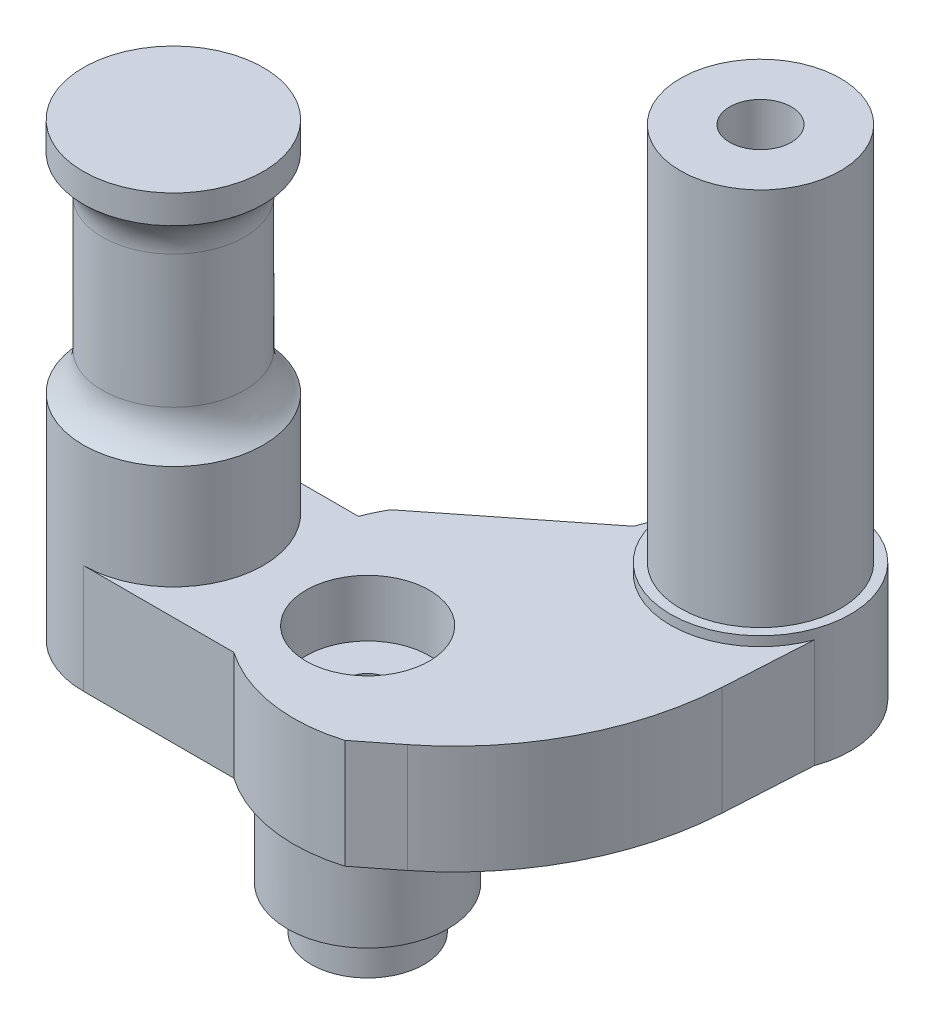
from build123d import *

# Parameters (mm, degrees)
SKETCH_1_R           = 5.95
EXTRUDE_1_DEPTH      = 4.5
SKETCH_4_R           = 8.45
EXTRUDE_4_DEPTH      = 17.75
EXTRUDE_6_DEPTH      = 5.75
EXTRUDE_6_DEPTH_BACK = 5.75
SKETCH_12_R          = 9.5
EXTRUDE_10_DEPTH     = 1
SKETCH_7_R           = 2.3
CUT_EXTRUDE_1_DEPTH  = 57.22806055
SKETCH_8_R           = 6.5
CUT_EXTRUDE_2_DEPTH  = 6
SKETCH_9_R           = 9.5
EXTRUDE_7_DEPTH      = 36
SKETCH_10_R          = 8.45
EXTRUDE_8_DEPTH      = 40
EXTRUDE_START        = 1
SKETCH_13_R          = 9.5
SKETCH_13_R_2        = 2.3
EXTRUDE_11_DEPTH     = 1
SKETCH_14_R          = 3.25
CUT_EXTRUDE_3_DEPTH  = 8
CUT_EXTRUDE_START    = -18
CUT_EXTRUDE_4_DEPTH  = 18
CUT_EXTRUDE_START_2  = 11
SKETCH_16_R          = 14.956390748
SKETCH_16_R_2        = 7.5
CUT_EXTRUDE_5_DEPTH  = 22
FILLET_2_R           = 5
SKETCH_18_R          = 7.5
EXTRUDE_12_DEPTH     = 11.5


with BuildPart() as part:
    # Эскиз1 → Бобышка-Вытянуть1 (new body)
    with BuildSketch(Plane(origin=(0, 0, 0), x_dir=(1, 0, 0), z_dir=(0, 1, 0))):
        with Locations(Location((0, 0, 0), (0, 0, 270))):
            Circle(SKETCH_1_R)
    extrude(amount=EXTRUDE_1_DEPTH)

    # Эскиз4 → Бобышка-Вытянуть4 (add)
    with BuildSketch(Plane(origin=(0, 4.5, 0), x_dir=(1, 0, 0), z_dir=(0, 1, 0))):
        with Locations(Location((0, 0, 0), (0, 0, 270))):
            Circle(SKETCH_4_R)
    extrude(amount=EXTRUDE_4_DEPTH)

    # Эскиз6 → Бобышка-Вытянуть6 (add, two sides: drawn at the far end of the back side and taken through both)
    with BuildSketch(Plane(origin=(0, 22.25, 0), x_dir=(1, 0, 0), z_dir=(0, 1, 0)).offset(-EXTRUDE_6_DEPTH_BACK)):
        with BuildLine():
            Line((-7.002075382, 9.5), (-30, 9.5))
            Line((-30, 9.5), (-30, -9.5))
            Line((-30, -9.5), (0, -9.5))
            Line((0, -9.5), (0.833655922, -9.5))
            ThreePointArc((0.833655922, -9.5), (3.331132848, -9.18310947), (5.670324417, -8.252521801))
            ThreePointArc((5.670324417, -8.252521801), (13.556905273, -2.05094269), (19.066851837, 6.333461279))
            Line((19.066851837, 6.333461279), (28.114764095, 31.1923959))
            Line((28.114764095, 31.1923959), (10.2606043, 37.690778624))
            Line((10.2606043, 37.690778624), (2.394850826, 16.079798567))
            ThreePointArc((2.394850826, 16.079798567), (-1.266311019, 11.308479557), (-7.002075382, 9.5))
        make_face()
    extrude(amount=EXTRUDE_6_DEPTH + EXTRUDE_6_DEPTH_BACK)

    # Эскиз12 → Бобышка-Вытянуть10 (add)
    with BuildSketch(Plane(origin=(0, 28, 0), x_dir=(1, 0, 0), z_dir=(0, 1, 0))):
        with Locations(Location((15.938492836, 25.514507365, 0), (0, 0, 70))):
            Circle(SKETCH_12_R)
    extrude(amount=EXTRUDE_10_DEPTH)

    # Эскиз7 → Вырез-Вытянуть1 (cut, through all)
    with BuildSketch(Plane.XZ):
        with Locations(Location((0, 0, 0), (0, 0, 270))):
            Circle(SKETCH_7_R)
    extrude(amount=-CUT_EXTRUDE_1_DEPTH, mode=Mode.SUBTRACT)

    # Эскиз8 → Вырез-Вытянуть2 (cut)
    with BuildSketch(Plane(origin=(0, 28, 0), x_dir=(1, 0, 0), z_dir=(0, 1, 0))):
        with Locations(Location((0, 0, 0), (0, 0, 270))):
            Circle(SKETCH_8_R)
    extrude(amount=-CUT_EXTRUDE_2_DEPTH, mode=Mode.SUBTRACT)

    # Эскиз9 → Бобышка-Вытянуть7 (add)
    with BuildSketch(Plane.XZ.offset(-28)):
        with Locations(Location((-20.5, 0, 0), (0, 0, 90))):
            Circle(SKETCH_9_R)
    extrude(amount=-EXTRUDE_7_DEPTH)

    # Эскиз10 → Бобышка-Вытянуть8 (add)
    with BuildSketch(Plane(origin=(0, 29, 0), x_dir=(1, 0, 0), z_dir=(0, 1, 0))):
        with Locations(Location((15.938492836, 25.514507365, 0), (0, 0, 270))):
            Circle(SKETCH_10_R)
    extrude(amount=EXTRUDE_8_DEPTH)

    # Эскиз13 → Бобышка-Вытянуть11 (add)
    with BuildSketch(Plane.XZ.offset(-16.5).offset(EXTRUDE_START)):
        with Locations(Location((0, 0, 0), (0, 0, 90))):
            Circle(SKETCH_13_R)
        with Locations(Location((0, 0, 0), (0, 0, 270))):
            Circle(SKETCH_13_R_2, mode=Mode.SUBTRACT)
    extrude(amount=-EXTRUDE_11_DEPTH)

    # Эскиз14 → Вырез-Вытянуть3 (cut)
    with BuildSketch(Plane(origin=(0, 69, 0), x_dir=(1, 0, 0), z_dir=(0, 1, 0))):
        with Locations(Location((15.938492836, 25.514507365, 0), (0, 0, 270))):
            Circle(SKETCH_14_R)
    extrude(amount=-CUT_EXTRUDE_3_DEPTH, mode=Mode.SUBTRACT)

    # Эскиз15 → Вырез-Вытянуть4 (cut)
    with BuildSketch(Plane(origin=(0, 28, 0), x_dir=(1, 0, 0), z_dir=(0, 1, 0)).offset(CUT_EXTRUDE_START)):
        with BuildLine():
            Line((-20.5, 9.5), (-20.5, 16.947416375))
            Line((-20.5, 16.947416375), (-42.12929037, 16.947416375))
            Line((-42.12929037, 16.947416375), (-42.12929037, -12.742276146))
            Line((-42.12929037, -12.742276146), (-20.5, -12.742276146))
            Line((-20.5, -12.742276146), (-20.5, -9.5))
            ThreePointArc((-20.5, -9.5), (-30, 0), (-20.5, 9.5))
        make_face()
        with BuildLine():
            Line((7.155380289, 29.134857346), (-1.255186481, 32.601646037))
            Line((-1.255186481, 32.601646037), (4.631093303, 46.881994095))
            Line((4.631093303, 46.881994095), (38.784745505, 32.804049238))
            Line((38.784745505, 32.804049238), (32.89846572, 18.523701179))
            Line((32.89846572, 18.523701179), (24.721605383, 21.894157383))
            ThreePointArc((24.721605383, 21.894157383), (19.558842817, 34.297619911), (7.155380289, 29.134857346))
        make_face()
    extrude(amount=CUT_EXTRUDE_4_DEPTH, mode=Mode.SUBTRACT)

    # Эскиз16 → Вырез-Вытянуть5 (cut)
    with BuildSketch(Plane(origin=(0, 28, 0), x_dir=(1, 0, 0), z_dir=(0, 1, 0)).offset(CUT_EXTRUDE_START_2)):
        with Locations((-20.5, 0)):
            Circle(SKETCH_16_R)
        with Locations(Location((-20.5, 0, 0), (0, 0, 270))):
            Circle(SKETCH_16_R_2, mode=Mode.SUBTRACT)
    extrude(amount=CUT_EXTRUDE_5_DEPTH, mode=Mode.SUBTRACT)

    # Скругление2
    # the kernel refuses this fillet: 5 mm, written as the material it adds along each edge
    with BuildSketch(Plane(origin=(-20.5, 39, 0), x_dir=(0, 0, 1), z_dir=(-1, 0, 0))) as fillet_2_piece_1:
        with BuildLine():
            CenterArc((12.5, 4), FILLET_2_R, 180, 53.130102354)
            Line((7.5, 4), (7.4, 4))
            Line((7.4, 4), (7.4, 0))
            Line((7.4, 0), (7.5, -0.1))
            ThreePointArc((7.5, -0.1), (8.5, -0.1), (9.44, -0.08))
            Line((9.44, -0.08), (9.5, 0))
        make_face()
    revolve(axis=Axis((-20.5, 39, 0), (0, 1, 0)))
    with BuildSketch(Plane(origin=(-20.5, 61, 0), x_dir=(0, 0, 1), z_dir=(-1, 0, 0))) as fillet_2_piece_2:
        with BuildLine():
            CenterArc((12.5, -4), FILLET_2_R, 126.869897646, 53.130102354)
            Line((9.5, 0), (9.44, 0.08))
            ThreePointArc((9.44, 0.08), (8.5, 0.1), (7.5, 0.1))
            Line((7.5, 0.1), (7.4, 0))
            Line((7.4, 0), (7.4, -4))
            Line((7.4, -4), (7.5, -4))
        make_face()
    revolve(axis=Axis((-20.5, 61, 0), (0, 1, 0)))

    # Эскиз18 → Бобышка-Вытянуть12 (add)
    with BuildSketch(Plane.XZ.offset(-16.5)):
        with BuildLine():
            Line((9.278482036, 11.69085434), (12.972576627, 8.775389277))
            ThreePointArc((12.972576627, 8.775389277), (20.997261978, -0.921608959), (24.337711873, -13.057042378))
            Line((24.337711873, -13.057042378), (24.865572733, -22.265316003))
            Line((24.865572733, -22.265316003), (5.413533881, -23.476451416))
            Line((5.413533881, -23.476451416), (-9.371872764, -11.807465836))
            ThreePointArc((-9.371872764, -11.807465836), (-8.040562687, 6.286337643), (9.278482036, 11.69085434))
        make_face()
        Circle(SKETCH_18_R, mode=Mode.SUBTRACT)
    extrude(amount=-EXTRUDE_12_DEPTH)


solid = part.part
